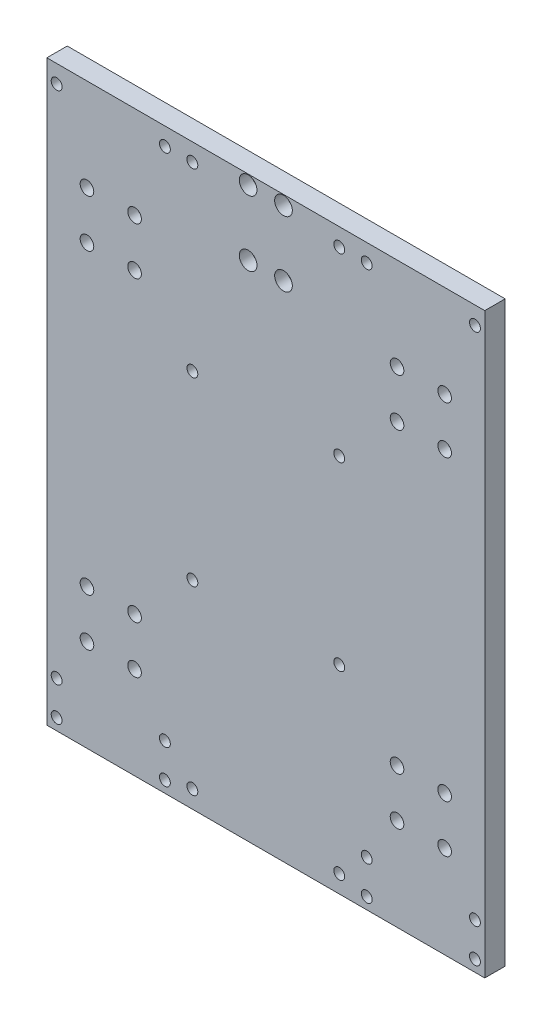
from build123d import *

# Parameters (mm, degrees)
SZKIC1_W                       = 322
SZKIC1_H                       = 425
DODANIE_WYCI_GNI_CIE1_DEPTH    = 15
SZKIC2_R                       = 3
WYTNIJ_WYCI_GNI_CIE1_DEPTH     = 15
SZKIC3_R                       = 5
WYTNIJ_WYCI_GNI_CIE2_DEPTH     = 7
SZYK_LINIOWY1_COUNT            = 2
SZYK_LINIOWY1_PITCH            = 35
SZYK_LINIOWY1_COUNT_DIR2       = 2
SZYK_LINIOWY1_PITCH_DIR2       = 35
SZYK_LINIOWY2_COPY_1_SKETCH_R  = 3
SZYK_LINIOWY2_COPY_1_DEPTH     = 15
SZYK_LINIOWY2_COPY_2_SKETCH_R  = 3
SZYK_LINIOWY2_COPY_2_DEPTH     = 15
SZYK_LINIOWY2_COPY_3_SKETCH_R  = 3
SZYK_LINIOWY2_COPY_3_DEPTH     = 15
SZYK_LINIOWY2_COPY_4_SKETCH_R  = 3
SZYK_LINIOWY2_COPY_4_DEPTH     = 15
SZYK_LINIOWY2_COPY_5_SKETCH_R  = 3
SZYK_LINIOWY2_COPY_5_DEPTH     = 15
SZYK_LINIOWY2_COPY_6_SKETCH_R  = 3
SZYK_LINIOWY2_COPY_6_DEPTH     = 15
SZYK_LINIOWY2_COPY_7_SKETCH_R  = 3
SZYK_LINIOWY2_COPY_7_DEPTH     = 15
SZYK_LINIOWY2_COPY_8_SKETCH_R  = 3
SZYK_LINIOWY2_COPY_8_DEPTH     = 15
SZYK_LINIOWY2_COPY_9_SKETCH_R  = 3
SZYK_LINIOWY2_COPY_9_DEPTH     = 15
SZYK_LINIOWY2_COPY_10_SKETCH_R = 5
SZYK_LINIOWY2_COPY_10_DEPTH    = 7
SZYK_LINIOWY2_COPY_11_SKETCH_R = 5
SZYK_LINIOWY2_COPY_11_DEPTH    = 7
SZYK_LINIOWY2_COPY_12_SKETCH_R = 5
SZYK_LINIOWY2_COPY_12_DEPTH    = 7
SZYK_LINIOWY2_COPY_13_SKETCH_R = 5
SZYK_LINIOWY2_COPY_13_DEPTH    = 7
SZYK_LINIOWY2_COPY_14_SKETCH_R = 5
SZYK_LINIOWY2_COPY_14_DEPTH    = 7
SZYK_LINIOWY2_COPY_15_SKETCH_R = 5
SZYK_LINIOWY2_COPY_15_DEPTH    = 7
SZYK_LINIOWY2_COPY_16_SKETCH_R = 5
SZYK_LINIOWY2_COPY_16_DEPTH    = 7
SZYK_LINIOWY2_COPY_17_SKETCH_R = 5
SZYK_LINIOWY2_COPY_17_DEPTH    = 7
SZYK_LINIOWY2_COPY_18_SKETCH_R = 5
SZYK_LINIOWY2_COPY_18_DEPTH    = 7
SZYK_LINIOWY2_COPY_19_SKETCH_R = 3
SZYK_LINIOWY2_COPY_19_DEPTH    = 15
SZYK_LINIOWY2_COPY_20_SKETCH_R = 3
SZYK_LINIOWY2_COPY_20_DEPTH    = 15
SZYK_LINIOWY2_COPY_21_SKETCH_R = 3
SZYK_LINIOWY2_COPY_21_DEPTH    = 15
SZYK_LINIOWY2_COPY_22_SKETCH_R = 5
SZYK_LINIOWY2_COPY_22_DEPTH    = 7
SZYK_LINIOWY2_COPY_23_SKETCH_R = 5
SZYK_LINIOWY2_COPY_23_DEPTH    = 7
SZYK_LINIOWY2_COPY_24_SKETCH_R = 5
SZYK_LINIOWY2_COPY_24_DEPTH    = 7
SZKIC6_R                       = 4
WYTNIJ_WYCI_GNI_CIE3_DEPTH     = 20
SZKIC7_R                       = 4
WYTNIJ_WYCI_GNI_CIE4_DEPTH     = 20
SZKIC10_R                      = 4
WYTNIJ_WYCI_GNI_CIE5_DEPTH     = 21
SZKIC11_R                      = 4
WYTNIJ_WYCI_GNI_CIE6_DEPTH     = 21
SZKIC12_R                      = 3.999999999
WYTNIJ_WYCI_GNI_CIE7_DEPTH     = 15
SZKIC13_R                      = 6.499999999
WYTNIJ_WYCI_GNI_CIE8_DEPTH     = 9
SZKIC14_R                      = 4
WYTNIJ_WYCI_GNI_CIE9_DEPTH     = 15
SZYK_LINIOWY3_COUNT            = 4
SZYK_LINIOWY3_PITCH            = 133


with BuildPart() as part:
    # Szkic1 → Dodanie-wyciągnięcie1 (new body)
    with BuildSketch(Plane.XY):
        Rectangle(SZKIC1_W, SZKIC1_H)
    extrude(amount=DODANIE_WYCI_GNI_CIE1_DEPTH)

    # Szkic2 → Wytnij-wyciągnięcie1 (cut)
    with BuildSketch(Plane.XY.offset(15)):
        with Locations((-131.5, 144.5)):
            Circle(SZKIC2_R)
    wytnij_wyci_gni_cie1 = extrude(amount=-WYTNIJ_WYCI_GNI_CIE1_DEPTH, mode=Mode.SUBTRACT)

    # Szkic3 → Wytnij-wyciągnięcie2 (cut)
    with BuildSketch(Plane.XY.offset(15)):
        with Locations((-131.5, 144.5)):
            Circle(SZKIC3_R)
    wytnij_wyci_gni_cie2 = extrude(amount=-WYTNIJ_WYCI_GNI_CIE2_DEPTH, mode=Mode.SUBTRACT)

    # Szyk liniowy1: Wytnij-wyciągnięcie1, Wytnij-wyci_gni_cie2 2 × 2
    with Locations(*[(i * SZYK_LINIOWY1_PITCH, -j * SZYK_LINIOWY1_PITCH_DIR2, 0) for i in range(SZYK_LINIOWY1_COUNT) for j in range(SZYK_LINIOWY1_COUNT_DIR2) if (i, j) != (0, 0)]):
        add(wytnij_wyci_gni_cie1, mode=Mode.SUBTRACT)
        add(wytnij_wyci_gni_cie2, mode=Mode.SUBTRACT)

    # Szyk liniowy2 copy 1 sketch → Szyk liniowy2 copy 1 (cut)
    with BuildSketch(Plane(origin=(0, -289, 15), x_dir=(1, 0, 0), z_dir=(0, 0, 1))):
        with Locations((-131.5, 144.5)):
            Circle(SZYK_LINIOWY2_COPY_1_SKETCH_R)
    extrude(amount=-SZYK_LINIOWY2_COPY_1_DEPTH, mode=Mode.SUBTRACT)

    # Szyk liniowy2 copy 2 sketch → Szyk liniowy2 copy 2 (cut)
    with BuildSketch(Plane(origin=(228, -35, 15), x_dir=(1, 0, 0), z_dir=(0, 0, 1))):
        with Locations((-131.5, 144.5)):
            Circle(SZYK_LINIOWY2_COPY_2_SKETCH_R)
    extrude(amount=-SZYK_LINIOWY2_COPY_2_DEPTH, mode=Mode.SUBTRACT)

    # Szyk liniowy2 copy 3 sketch → Szyk liniowy2 copy 3 (cut)
    with BuildSketch(Plane(origin=(228, -289, 15), x_dir=(1, 0, 0), z_dir=(0, 0, 1))):
        with Locations((-131.5, 144.5)):
            Circle(SZYK_LINIOWY2_COPY_3_SKETCH_R)
    extrude(amount=-SZYK_LINIOWY2_COPY_3_DEPTH, mode=Mode.SUBTRACT)

    # Szyk liniowy2 copy 4 sketch → Szyk liniowy2 copy 4 (cut)
    with BuildSketch(Plane(origin=(35, -254, 15), x_dir=(1, 0, 0), z_dir=(0, 0, 1))):
        with Locations((-131.5, 144.5)):
            Circle(SZYK_LINIOWY2_COPY_4_SKETCH_R)
    extrude(amount=-SZYK_LINIOWY2_COPY_4_DEPTH, mode=Mode.SUBTRACT)

    # Szyk liniowy2 copy 5 sketch → Szyk liniowy2 copy 5 (cut)
    with BuildSketch(Plane(origin=(263, 0, 15), x_dir=(1, 0, 0), z_dir=(0, 0, 1))):
        with Locations((-131.5, 144.5)):
            Circle(SZYK_LINIOWY2_COPY_5_SKETCH_R)
    extrude(amount=-SZYK_LINIOWY2_COPY_5_DEPTH, mode=Mode.SUBTRACT)

    # Szyk liniowy2 copy 6 sketch → Szyk liniowy2 copy 6 (cut)
    with BuildSketch(Plane(origin=(263, -254, 15), x_dir=(1, 0, 0), z_dir=(0, 0, 1))):
        with Locations((-131.5, 144.5)):
            Circle(SZYK_LINIOWY2_COPY_6_SKETCH_R)
    extrude(amount=-SZYK_LINIOWY2_COPY_6_DEPTH, mode=Mode.SUBTRACT)

    # Szyk liniowy2 copy 7 sketch → Szyk liniowy2 copy 7 (cut)
    with BuildSketch(Plane(origin=(35, -289, 15), x_dir=(1, 0, 0), z_dir=(0, 0, 1))):
        with Locations((-131.5, 144.5)):
            Circle(SZYK_LINIOWY2_COPY_7_SKETCH_R)
    extrude(amount=-SZYK_LINIOWY2_COPY_7_DEPTH, mode=Mode.SUBTRACT)

    # Szyk liniowy2 copy 8 sketch → Szyk liniowy2 copy 8 (cut)
    with BuildSketch(Plane(origin=(263, -35, 15), x_dir=(1, 0, 0), z_dir=(0, 0, 1))):
        with Locations((-131.5, 144.5)):
            Circle(SZYK_LINIOWY2_COPY_8_SKETCH_R)
    extrude(amount=-SZYK_LINIOWY2_COPY_8_DEPTH, mode=Mode.SUBTRACT)

    # Szyk liniowy2 copy 9 sketch → Szyk liniowy2 copy 9 (cut)
    with BuildSketch(Plane(origin=(263, -289, 15), x_dir=(1, 0, 0), z_dir=(0, 0, 1))):
        with Locations((-131.5, 144.5)):
            Circle(SZYK_LINIOWY2_COPY_9_SKETCH_R)
    extrude(amount=-SZYK_LINIOWY2_COPY_9_DEPTH, mode=Mode.SUBTRACT)

    # Szyk liniowy2 copy 10 sketch → Szyk liniowy2 copy 10 (cut)
    with BuildSketch(Plane(origin=(0, -289, 15), x_dir=(1, 0, 0), z_dir=(0, 0, 1))):
        with Locations((-131.5, 144.5)):
            Circle(SZYK_LINIOWY2_COPY_10_SKETCH_R)
    extrude(amount=-SZYK_LINIOWY2_COPY_10_DEPTH, mode=Mode.SUBTRACT)

    # Szyk liniowy2 copy 11 sketch → Szyk liniowy2 copy 11 (cut)
    with BuildSketch(Plane(origin=(228, -35, 15), x_dir=(1, 0, 0), z_dir=(0, 0, 1))):
        with Locations((-131.5, 144.5)):
            Circle(SZYK_LINIOWY2_COPY_11_SKETCH_R)
    extrude(amount=-SZYK_LINIOWY2_COPY_11_DEPTH, mode=Mode.SUBTRACT)

    # Szyk liniowy2 copy 12 sketch → Szyk liniowy2 copy 12 (cut)
    with BuildSketch(Plane(origin=(228, -289, 15), x_dir=(1, 0, 0), z_dir=(0, 0, 1))):
        with Locations((-131.5, 144.5)):
            Circle(SZYK_LINIOWY2_COPY_12_SKETCH_R)
    extrude(amount=-SZYK_LINIOWY2_COPY_12_DEPTH, mode=Mode.SUBTRACT)

    # Szyk liniowy2 copy 13 sketch → Szyk liniowy2 copy 13 (cut)
    with BuildSketch(Plane(origin=(35, -254, 15), x_dir=(1, 0, 0), z_dir=(0, 0, 1))):
        with Locations((-131.5, 144.5)):
            Circle(SZYK_LINIOWY2_COPY_13_SKETCH_R)
    extrude(amount=-SZYK_LINIOWY2_COPY_13_DEPTH, mode=Mode.SUBTRACT)

    # Szyk liniowy2 copy 14 sketch → Szyk liniowy2 copy 14 (cut)
    with BuildSketch(Plane(origin=(263, 0, 15), x_dir=(1, 0, 0), z_dir=(0, 0, 1))):
        with Locations((-131.5, 144.5)):
            Circle(SZYK_LINIOWY2_COPY_14_SKETCH_R)
    extrude(amount=-SZYK_LINIOWY2_COPY_14_DEPTH, mode=Mode.SUBTRACT)

    # Szyk liniowy2 copy 15 sketch → Szyk liniowy2 copy 15 (cut)
    with BuildSketch(Plane(origin=(263, -254, 15), x_dir=(1, 0, 0), z_dir=(0, 0, 1))):
        with Locations((-131.5, 144.5)):
            Circle(SZYK_LINIOWY2_COPY_15_SKETCH_R)
    extrude(amount=-SZYK_LINIOWY2_COPY_15_DEPTH, mode=Mode.SUBTRACT)

    # Szyk liniowy2 copy 16 sketch → Szyk liniowy2 copy 16 (cut)
    with BuildSketch(Plane(origin=(35, -289, 15), x_dir=(1, 0, 0), z_dir=(0, 0, 1))):
        with Locations((-131.5, 144.5)):
            Circle(SZYK_LINIOWY2_COPY_16_SKETCH_R)
    extrude(amount=-SZYK_LINIOWY2_COPY_16_DEPTH, mode=Mode.SUBTRACT)

    # Szyk liniowy2 copy 17 sketch → Szyk liniowy2 copy 17 (cut)
    with BuildSketch(Plane(origin=(263, -35, 15), x_dir=(1, 0, 0), z_dir=(0, 0, 1))):
        with Locations((-131.5, 144.5)):
            Circle(SZYK_LINIOWY2_COPY_17_SKETCH_R)
    extrude(amount=-SZYK_LINIOWY2_COPY_17_DEPTH, mode=Mode.SUBTRACT)

    # Szyk liniowy2 copy 18 sketch → Szyk liniowy2 copy 18 (cut)
    with BuildSketch(Plane(origin=(263, -289, 15), x_dir=(1, 0, 0), z_dir=(0, 0, 1))):
        with Locations((-131.5, 144.5)):
            Circle(SZYK_LINIOWY2_COPY_18_SKETCH_R)
    extrude(amount=-SZYK_LINIOWY2_COPY_18_DEPTH, mode=Mode.SUBTRACT)

    # Szyk liniowy2 copy 19 sketch → Szyk liniowy2 copy 19 (cut)
    with BuildSketch(Plane(origin=(0, -254, 15), x_dir=(1, 0, 0), z_dir=(0, 0, 1))):
        with Locations((-131.5, 144.5)):
            Circle(SZYK_LINIOWY2_COPY_19_SKETCH_R)
    extrude(amount=-SZYK_LINIOWY2_COPY_19_DEPTH, mode=Mode.SUBTRACT)

    # Szyk liniowy2 copy 20 sketch → Szyk liniowy2 copy 20 (cut)
    with BuildSketch(Plane(origin=(228, 0, 15), x_dir=(1, 0, 0), z_dir=(0, 0, 1))):
        with Locations((-131.5, 144.5)):
            Circle(SZYK_LINIOWY2_COPY_20_SKETCH_R)
    extrude(amount=-SZYK_LINIOWY2_COPY_20_DEPTH, mode=Mode.SUBTRACT)

    # Szyk liniowy2 copy 21 sketch → Szyk liniowy2 copy 21 (cut)
    with BuildSketch(Plane(origin=(228, -254, 15), x_dir=(1, 0, 0), z_dir=(0, 0, 1))):
        with Locations((-131.5, 144.5)):
            Circle(SZYK_LINIOWY2_COPY_21_SKETCH_R)
    extrude(amount=-SZYK_LINIOWY2_COPY_21_DEPTH, mode=Mode.SUBTRACT)

    # Szyk liniowy2 copy 22 sketch → Szyk liniowy2 copy 22 (cut)
    with BuildSketch(Plane(origin=(0, -254, 15), x_dir=(1, 0, 0), z_dir=(0, 0, 1))):
        with Locations((-131.5, 144.5)):
            Circle(SZYK_LINIOWY2_COPY_22_SKETCH_R)
    extrude(amount=-SZYK_LINIOWY2_COPY_22_DEPTH, mode=Mode.SUBTRACT)

    # Szyk liniowy2 copy 23 sketch → Szyk liniowy2 copy 23 (cut)
    with BuildSketch(Plane(origin=(228, 0, 15), x_dir=(1, 0, 0), z_dir=(0, 0, 1))):
        with Locations((-131.5, 144.5)):
            Circle(SZYK_LINIOWY2_COPY_23_SKETCH_R)
    extrude(amount=-SZYK_LINIOWY2_COPY_23_DEPTH, mode=Mode.SUBTRACT)

    # Szyk liniowy2 copy 24 sketch → Szyk liniowy2 copy 24 (cut)
    with BuildSketch(Plane(origin=(228, -254, 15), x_dir=(1, 0, 0), z_dir=(0, 0, 1))):
        with Locations((-131.5, 144.5)):
            Circle(SZYK_LINIOWY2_COPY_24_SKETCH_R)
    extrude(amount=-SZYK_LINIOWY2_COPY_24_DEPTH, mode=Mode.SUBTRACT)

    # Szkic6 → Wytnij-wyciągnięcie3 (cut)
    with BuildSketch(Plane.XY.offset(15)):
        with Locations((-153.8, 199.5)):
            Circle(SZKIC6_R)
        with Locations((-74.2, 199.5)):
            Circle(SZKIC6_R)
    extrude(amount=-WYTNIJ_WYCI_GNI_CIE3_DEPTH, mode=Mode.SUBTRACT)

    # Szkic7 → Wytnij-wyciągnięcie4 (cut)
    with BuildSketch(Plane.XY.offset(15)):
        with Locations((-153.8, -204)):
            Circle(SZKIC7_R)
        with Locations((-153.8, -179)):
            Circle(SZKIC7_R)
        with Locations((-74.2, -204)):
            Circle(SZKIC7_R)
        with Locations((-74.2, -179)):
            Circle(SZKIC7_R)
    extrude(amount=-WYTNIJ_WYCI_GNI_CIE4_DEPTH, mode=Mode.SUBTRACT)

    # Szkic10 → Wytnij-wyciągnięcie5 (cut)
    with BuildSketch(Plane.XY.offset(15)):
        with Locations((74.2, 199.5)):
            Circle(SZKIC10_R)
        with Locations((153.8, 199.5)):
            Circle(SZKIC10_R)
    extrude(amount=-WYTNIJ_WYCI_GNI_CIE5_DEPTH, mode=Mode.SUBTRACT)

    # Szkic11 → Wytnij-wyciągnięcie6 (cut)
    with BuildSketch(Plane.XY.offset(15)):
        with Locations((153.8, -179)):
            Circle(SZKIC11_R)
        with Locations((153.8, -204)):
            Circle(SZKIC11_R)
        with Locations((74.2, -204)):
            Circle(SZKIC11_R)
        with Locations((74.2, -179)):
            Circle(SZKIC11_R)
    extrude(amount=-WYTNIJ_WYCI_GNI_CIE6_DEPTH, mode=Mode.SUBTRACT)

    # Szkic12 → Wytnij-wyciągnięcie7 (cut)
    with BuildSketch(Plane.XY.offset(15)):
        with Locations((-13, 205.5)):
            Circle(SZKIC12_R)
        with Locations((13, 205.5)):
            Circle(SZKIC12_R)
        with Locations((-13, 157.5)):
            Circle(SZKIC12_R)
        with Locations((13, 157.5)):
            Circle(SZKIC12_R)
    extrude(amount=-WYTNIJ_WYCI_GNI_CIE7_DEPTH, mode=Mode.SUBTRACT)

    # Szkic13 → Wytnij-wyciągnięcie8 (cut)
    with BuildSketch(Plane.XY.offset(15)):
        with Locations((-13, 205.5)):
            Circle(SZKIC13_R)
        with Locations((13, 205.5)):
            Circle(SZKIC13_R)
        with Locations((13, 157.5)):
            Circle(SZKIC13_R)
        with Locations((-13, 157.5)):
            Circle(SZKIC13_R)
    extrude(amount=-WYTNIJ_WYCI_GNI_CIE8_DEPTH, mode=Mode.SUBTRACT)

    # Szkic14 → Wytnij-wyciągnięcie9 (cut)
    with BuildSketch(Plane.XY.offset(15)):
        with Locations((-54, 199.5)):
            Circle(SZKIC14_R)
        with Locations((54, 199.5)):
            Circle(SZKIC14_R)
    wytnij_wyci_gni_cie9 = extrude(amount=-WYTNIJ_WYCI_GNI_CIE9_DEPTH, mode=Mode.SUBTRACT)

    # Szyk liniowy3: Wytnij-wyciągnięcie9 ×4
    with Locations(*[(0, -i * SZYK_LINIOWY3_PITCH, 0) for i in range(1, SZYK_LINIOWY3_COUNT)]):
        add(wytnij_wyci_gni_cie9, mode=Mode.SUBTRACT)


solid = part.part
